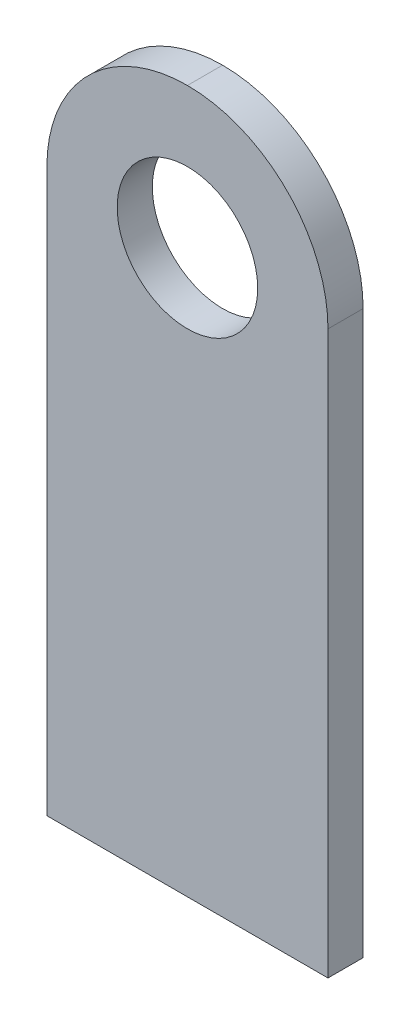
from build123d import *

# Parameters (mm, degrees)
SKETCH1_W           = 4
SKETCH1_H           = 0.5
BOSS_EXTRUDE1_DEPTH = 10
FILLET1_R           = 2
SKETCH2_R           = 1
CUT_EXTRUDE1_DEPTH  = 0.5


with BuildPart() as part:
    # Sketch1 → Boss-Extrude1 (new body)
    with BuildSketch(Plane(origin=(0, 0, 0), x_dir=(1, 0, 0), z_dir=(0, 1, 0))):
        Rectangle(SKETCH1_W, SKETCH1_H)
    extrude(amount=BOSS_EXTRUDE1_DEPTH)

    # Fillet1
    fillet1_edges = [part.edges().sort_by_distance(p)[0] for p in [
        (-2, 10, 0),
        (2, 10, 0),
    ]]
    fillet(fillet1_edges, radius=FILLET1_R - 0.0001)  # a hair under: the kernel refuses the full size

    # Sketch2 → Cut-Extrude1 (cut)
    with BuildSketch(Plane.XY.offset(0.25)):
        with Locations((0, 8)):
            Circle(SKETCH2_R)
    extrude(amount=-CUT_EXTRUDE1_DEPTH, mode=Mode.SUBTRACT)


solid = part.part
